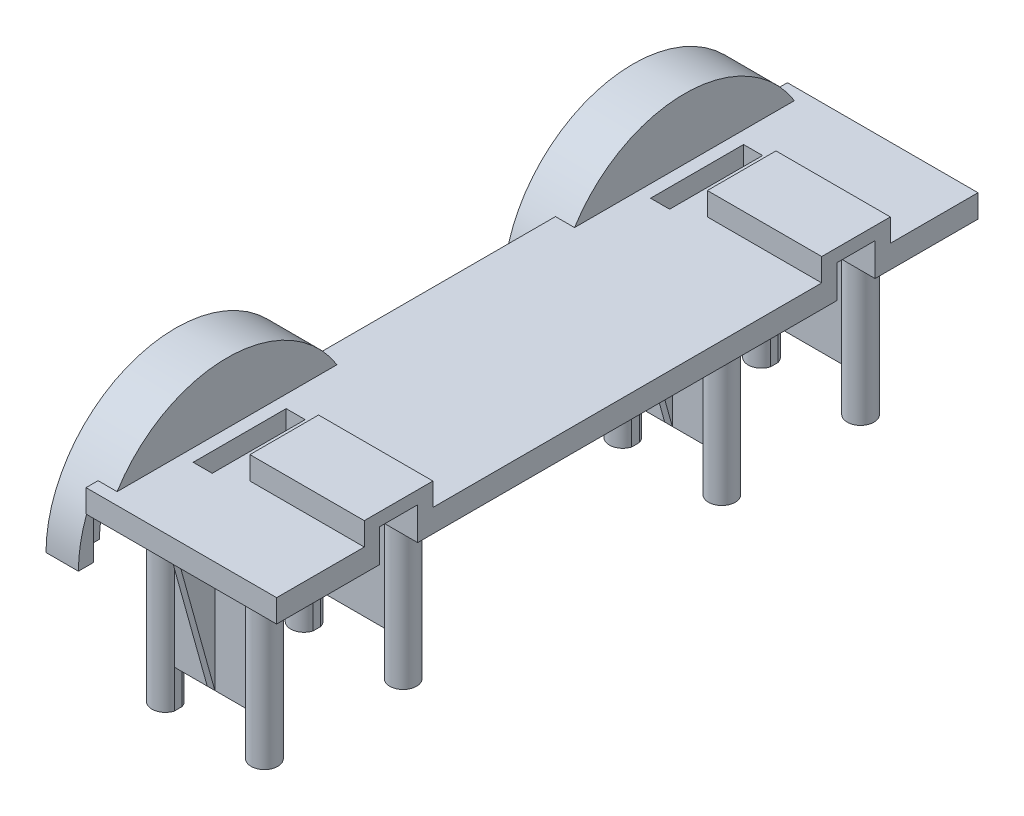
from build123d import *

# Parameters (mm, degrees)
SKETCH1_W           = 25
SKETCH1_H           = 46
SKETCH1_W_2         = 2.5
SKETCH1_H_2         = 12.2
BOSS_EXTRUDE1_DEPTH = 3
R_VOLUTION1_START   = -4.25
R_VOLUTION1_DEPTH   = 6.75
R_VOLUTION1_START_2 = 0.5
R_VOLUTION1_2_DEPTH = 2
R_VOLUTION1_3_DEPTH = 2
SKETCH9_W           = 11.354173072
SKETCH9_H           = 3.73743218
SKETCH9_W_2         = 2
SKETCH9_H_2         = 6
CUT_EXTRUDE2_DEPTH  = 6
CUT_EXTRUDE8_DEPTH  = 0.5
BOSS_EXTRUDE2_DEPTH = 23
SKETCH10_R          = 1
CUT_EXTRUDE3_DEPTH  = 10
SKETCH11_W          = 15
SKETCH11_H          = 9
BOSS_EXTRUDE3_DEPTH = 3
SKETCH12_W          = 5
SKETCH12_H          = 4.302239334
CUT_EXTRUDE4_DEPTH  = 13
SKETCH1_10_W        = 1
SKETCH1_10_H        = 5
BOSS_EXTRUDE4_DEPTH = 18
CUT_EXTRUDE5_DEPTH  = 1
CUT_EXTRUDE9_DEPTH  = 0.5


with BuildPart() as part:
    # Sketch1 → Boss-Extrude1 (new body)
    with BuildSketch(Plane(origin=(0, 0, 0), x_dir=(1, 0, 0), z_dir=(0, 1, 0))):
        with Locations((12.5, 15)):
            Rectangle(SKETCH1_W, SKETCH1_H)
        with Locations((5.4, 8)):
            Rectangle(SKETCH1_W_2, SKETCH1_H_2, mode=Mode.SUBTRACT)
    boss_extrude1 = extrude(amount=BOSS_EXTRUDE1_DEPTH)

    # Révolution1: read off the stored shape, not the designer's step
    # Révolution1 outline → Révolution1 (add)
    with BuildSketch(Plane.YZ.offset(R_VOLUTION1_START)):
        with BuildLine():
            Line((-6, 9), (-6, 7))
            ThreePointArc((-6, 7), (9, -8), (-6, -23))
            Line((-6, -23), (-6, -25))
            ThreePointArc((-6, -25), (11, -8), (-6, 9))
        make_face()
    r_volution1 = extrude(amount=R_VOLUTION1_DEPTH)

    # R_volution1 2 outline → R_volution1 2 (add)
    with BuildSketch(Plane.YZ.offset(R_VOLUTION1_START_2)):
        with BuildLine():
            ThreePointArc((-6, 1), (-2.788601192, 0.407551231), (0, -1.291796068))
            Line((0, -1.291796068), (0, 5.747727085))
            ThreePointArc((0, 5.747727085), (-2.935355345, 6.683594694), (-6, 7))
            Line((-6, 7), (-6, 1))
        make_face()
        with BuildLine():
            ThreePointArc((0, -14.708203932), (-2.788601192, -16.407551231), (-6, -17))
            Line((-6, -17), (-6, -23))
            ThreePointArc((-6, -23), (-2.935355345, -22.683594694), (0, -21.747727085))
            Line((0, -21.747727085), (0, -14.708203932))
        make_face()
        with BuildLine():
            Line((3, 4), (3, -20))
            ThreePointArc((3, -20), (9, -8), (3, 4))
        make_face()
    r_volution1_2 = extrude(amount=R_VOLUTION1_2_DEPTH)

    # R_volution1 3 outline → R_volution1 3 (add)
    with BuildSketch(Plane.YZ.offset(R_VOLUTION1_START)):
        with BuildLine():
            Line((-6, 7), (-6, 4))
            ThreePointArc((-6, 4), (6, -8), (-6, -20))
            Line((-6, -20), (-6, -23))
            ThreePointArc((-6, -23), (9, -8), (-6, 7))
        make_face()
    r_volution1_3 = extrude(amount=R_VOLUTION1_3_DEPTH)

    # Sketch9 → Cut-Extrude2 (cut)
    with BuildSketch(Plane(origin=(0, -6, 0), x_dir=(-1, 0, 0), z_dir=(0, -1, 0))):
        with Locations((-5.677086536, 24.86871609)):
            Rectangle(SKETCH9_W, SKETCH9_H)
        Polygon((0, -9), (0, -7), (-0.5, -7), (-2.5, -7), (-2.5, -9), align=None)
        Polygon((0, -9.458628642), (0, -9), (-2.5, -9), (-2.5, -7), (-11.354173072, -7), (-11.354173072, -9.458628642), align=None)
        with Locations((-1.5, -4)):
            Rectangle(SKETCH9_W_2, SKETCH9_H_2)
        Polygon((0, -7), (2.25, -7), (2.25, -4), (2.25, 23), (0, 23), (-11.354173072, 23), (-11.354173072, -7), (-2.5, -7), (-2.5, -1), (-0.5, -1), (-0.5, -7), align=None)
    extrude(amount=-CUT_EXTRUDE2_DEPTH, mode=Mode.SUBTRACT)

    # Cut-Extrude8: read off the stored shape, not the designer's step
    # Cut-Extrude8 outline → Cut-Extrude8 (cut)
    with BuildSketch(Plane.YZ):
        with BuildLine():
            Line((0, 5.747727085), (0, -21.747727085))
            ThreePointArc((0, -21.747727085), (1.550737546, -20.960955309), (3, -20))
            Line((3, -20), (3, 4))
            ThreePointArc((3, 4), (1.550737546, 4.960955309), (0, 5.747727085))
        make_face()
    extrude(amount=CUT_EXTRUDE8_DEPTH, mode=Mode.SUBTRACT)

    # Sketch1<9> → Boss-Extrude2 (add)
    with BuildSketch(Plane(origin=(0, 0, 0), x_dir=(1, 0, 0), z_dir=(0, 1, 0))):
        with BuildLine():
            ThreePointArc((5.177050983, 17.6), (1.75, 17.1), (5.177050983, 16.6))
            Line((5.177050983, 16.6), (5.177050983, 17.6))
        make_face()
        with BuildLine():
            Line((5.177050983, -1.6), (5.177050983, -0.6))
            ThreePointArc((5.177050983, -0.6), (1.75, -1.1), (5.177050983, -1.6))
        make_face()
        with BuildLine():
            ThreePointArc((14.822949017, 16.6), (18.25, 17.1), (14.822949017, 17.6))
            Line((14.822949017, 17.6), (14.822949017, 16.6))
        make_face()
        with BuildLine():
            Line((14.822949017, -0.6), (14.822949017, -1.6))
            ThreePointArc((14.822949017, -1.6), (18.25, -1.1), (14.822949017, -0.6))
        make_face()
    boss_extrude2 = extrude(amount=-BOSS_EXTRUDE2_DEPTH)

    # Sketch10 → Cut-Extrude3 (cut)
    with BuildSketch(Plane(origin=(0, -23, 0), x_dir=(-1, 0, 0), z_dir=(0, -1, 0))):
        with Locations(Location((-3.5, -1.1, 0), (0, 0, 90))):
            Circle(SKETCH10_R)
        with Locations(Location((-16.5, -1.1, 0), (0, 0, 90))):
            Circle(SKETCH10_R)
        with Locations(Location((-16.5, 17.1, 0), (0, 0, 90))):
            Circle(SKETCH10_R)
        with Locations(Location((-3.5, 17.1, 0), (0, 0, 90))):
            Circle(SKETCH10_R)
    cut_extrude3 = extrude(amount=-CUT_EXTRUDE3_DEPTH, mode=Mode.SUBTRACT)

    # Sketch11 → Boss-Extrude3 (add)
    with BuildSketch(Plane(origin=(0, 3, 0), x_dir=(1, 0, 0), z_dir=(0, 1, 0))):
        with Locations((17.5, 8)):
            Rectangle(SKETCH11_W, SKETCH11_H)
    boss_extrude3 = extrude(amount=BOSS_EXTRUDE3_DEPTH)

    # Sketch12 → Cut-Extrude4 (cut)
    with BuildSketch(Plane(origin=(25, 0, 0), x_dir=(0, 0, -1), z_dir=(1, 0, 0))):
        with Locations((8, 2.151119667)):
            Rectangle(SKETCH12_W, SKETCH12_H)
    cut_extrude4 = extrude(amount=-CUT_EXTRUDE4_DEPTH, mode=Mode.SUBTRACT)

    # Sketch1<10> → Boss-Extrude4 (add)
    with BuildSketch(Plane(origin=(0, 0, 0), x_dir=(1, 0, 0), z_dir=(0, 1, 0))):
        with BuildLine():
            Line((14.822949017, -1.6), (14.822949017, -0.6))
            ThreePointArc((14.822949017, -0.6), (14.75, -1.1), (14.822949017, -1.6))
        make_face()
        with BuildLine():
            Line((14.822949017, -0.6), (13.541960108, -0.6))
            ThreePointArc((13.541960108, -0.6), (13.5, -1.1), (13.541960108, -1.6))
            Line((13.541960108, -1.6), (14.822949017, -1.6))
            ThreePointArc((14.822949017, -1.6), (14.75, -1.1), (14.822949017, -0.6))
        make_face()
        with BuildLine():
            ThreePointArc((6.5, -1.1), (6.489491568, -1.350878781), (6.458039892, -1.6))
            Line((6.458039892, -1.6), (9.5, -1.6))
            Line((9.5, -1.6), (10.5, -1.6))
            Line((10.5, -1.6), (13.541960108, -1.6))
            ThreePointArc((13.541960108, -1.6), (13.5, -1.1), (13.541960108, -0.6))
            Line((13.541960108, -0.6), (6.458039892, -0.6))
            ThreePointArc((6.458039892, -0.6), (6.489491568, -0.849121219), (6.5, -1.1))
        make_face()
        with Locations((10, -4.1)):
            Rectangle(SKETCH1_10_W, SKETCH1_10_H)
        with BuildLine():
            Line((5.177050983, -1.6), (6.458039892, -1.6))
            ThreePointArc((6.458039892, -1.6), (6.489491568, -1.350878781), (6.5, -1.1))
            ThreePointArc((6.5, -1.1), (6.489491568, -0.849121219), (6.458039892, -0.6))
            Line((6.458039892, -0.6), (5.177050983, -0.6))
            ThreePointArc((5.177050983, -0.6), (5.231666715, -0.847353231), (5.25, -1.1))
            ThreePointArc((5.25, -1.1), (5.231666715, -1.352646769), (5.177050983, -1.6))
        make_face()
        with BuildLine():
            Line((5.177050983, -0.6), (5.177050983, -1.6))
            ThreePointArc((5.177050983, -1.6), (5.231666715, -1.352646769), (5.25, -1.1))
            ThreePointArc((5.25, -1.1), (5.231666715, -0.847353231), (5.177050983, -0.6))
        make_face()
        with BuildLine():
            ThreePointArc((13.541960108, 17.6), (13.5, 17.1), (13.541960108, 16.6))
            Line((13.541960108, 16.6), (14.822949017, 16.6))
            ThreePointArc((14.822949017, 16.6), (14.75, 17.1), (14.822949017, 17.6))
            Line((14.822949017, 17.6), (13.541960108, 17.6))
        make_face()
        with BuildLine():
            ThreePointArc((14.822949017, 17.6), (14.75, 17.1), (14.822949017, 16.6))
            Line((14.822949017, 16.6), (14.822949017, 17.6))
        make_face()
        with BuildLine():
            Line((9.5, 17.6), (6.458039892, 17.6))
            ThreePointArc((6.458039892, 17.6), (6.489491568, 17.350878781), (6.5, 17.1))
            ThreePointArc((6.5, 17.1), (6.489491568, 16.849121219), (6.458039892, 16.6))
            Line((6.458039892, 16.6), (13.541960108, 16.6))
            ThreePointArc((13.541960108, 16.6), (13.5, 17.1), (13.541960108, 17.6))
            Line((13.541960108, 17.6), (10.5, 17.6))
            Line((10.5, 17.6), (9.5, 17.6))
        make_face()
        with BuildLine():
            ThreePointArc((6.5, 17.1), (6.489491568, 17.350878781), (6.458039892, 17.6))
            Line((6.458039892, 17.6), (5.177050983, 17.6))
            ThreePointArc((5.177050983, 17.6), (5.231666715, 17.352646769), (5.25, 17.1))
            ThreePointArc((5.25, 17.1), (5.231666715, 16.847353231), (5.177050983, 16.6))
            Line((5.177050983, 16.6), (6.458039892, 16.6))
            ThreePointArc((6.458039892, 16.6), (6.489491568, 16.849121219), (6.5, 17.1))
        make_face()
        with BuildLine():
            ThreePointArc((5.25, 17.1), (5.231666715, 17.352646769), (5.177050983, 17.6))
            Line((5.177050983, 17.6), (5.177050983, 16.6))
            ThreePointArc((5.177050983, 16.6), (5.231666715, 16.847353231), (5.25, 17.1))
        make_face()
        with Locations((10, 20.1)):
            Rectangle(SKETCH1_10_W, SKETCH1_10_H)
    boss_extrude4 = extrude(amount=-BOSS_EXTRUDE4_DEPTH)

    # Sketch14 → Cut-Extrude5 (cut)
    with BuildSketch(Plane.ZY.offset(-9.5)):
        Polygon((-22.6, 0), (-17.6, -18), (-22.6, -18), align=None)
        Polygon((6.6, -18), (6.6, 0), (1.6, -18), align=None)
    cut_extrude5 = extrude(amount=-CUT_EXTRUDE5_DEPTH, mode=Mode.SUBTRACT)

    # Mirror2: Boss-Extrude1, Révolution1, R_volution1 2, R_volution1 3, Boss-Extrude2, Cut-Extrude3, Boss-Extrude3, Cut-Extrude4, Boss-Extrude4, Cut-Extrude5 across plane
    add(boss_extrude1.mirror(Plane(origin=(0, 3, -38), x_dir=(1, 0, 0), z_dir=(0, 0, -1))))
    add(r_volution1.mirror(Plane(origin=(0, 3, -38), x_dir=(1, 0, 0), z_dir=(0, 0, -1))))
    add(r_volution1_2.mirror(Plane(origin=(0, 3, -38), x_dir=(1, 0, 0), z_dir=(0, 0, -1))))
    add(r_volution1_3.mirror(Plane(origin=(0, 3, -38), x_dir=(1, 0, 0), z_dir=(0, 0, -1))))
    add(boss_extrude2.mirror(Plane(origin=(0, 3, -38), x_dir=(1, 0, 0), z_dir=(0, 0, -1))))
    add(cut_extrude3.mirror(Plane(origin=(0, 3, -38), x_dir=(1, 0, 0), z_dir=(0, 0, -1))), mode=Mode.SUBTRACT)
    add(boss_extrude3.mirror(Plane(origin=(0, 3, -38), x_dir=(1, 0, 0), z_dir=(0, 0, -1))))
    add(cut_extrude4.mirror(Plane(origin=(0, 3, -38), x_dir=(1, 0, 0), z_dir=(0, 0, -1))), mode=Mode.SUBTRACT)
    add(boss_extrude4.mirror(Plane(origin=(0, 3, -38), x_dir=(1, 0, 0), z_dir=(0, 0, -1))))
    add(cut_extrude5.mirror(Plane(origin=(0, 3, -38), x_dir=(1, 0, 0), z_dir=(0, 0, -1))), mode=Mode.SUBTRACT)

    # Cut-Extrude9: read off the stored shape, not the designer's step
    # Cut-Extrude9 outline → Cut-Extrude9 (cut)
    with BuildSketch(Plane.YZ):
        with BuildLine():
            Line((0, -54.252272915), (0, -81.747727085))
            ThreePointArc((0, -81.747727085), (1.550737546, -80.960955309), (3, -80))
            Line((3, -80), (3, -56))
            ThreePointArc((3, -56), (1.550737546, -55.039044691), (0, -54.252272915))
        make_face()
    extrude(amount=CUT_EXTRUDE9_DEPTH, mode=Mode.SUBTRACT)


solid = part.part
